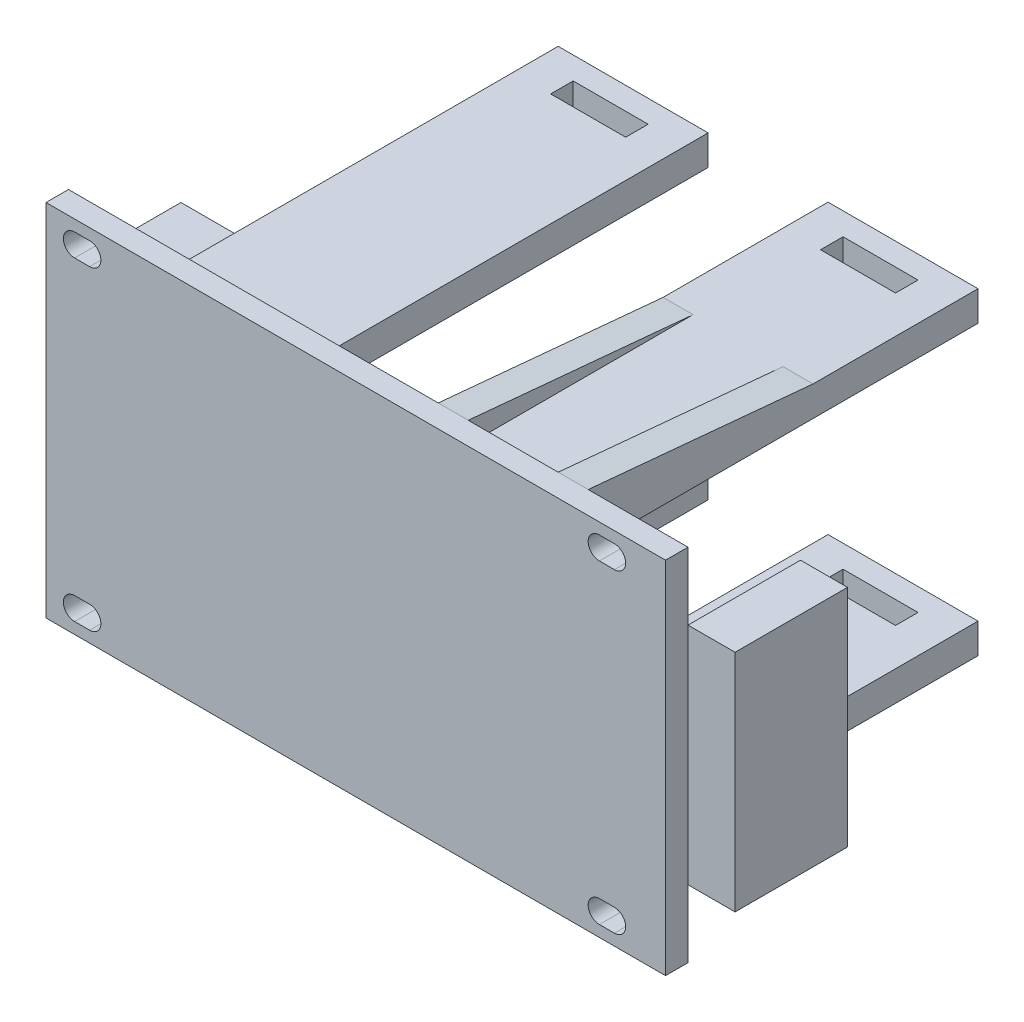
from build123d import *

# Parameters (mm, degrees)
SKETCH_2_W               = 82.637997944
SKETCH_2_H               = 48
EXTRUDE_1_DEPTH          = 3
SKETCH_3_W               = 20
SKETCH_3_H               = 4
EXTRUDE_2_DEPTH          = 53
SKETCH_4_W               = 13.514067067
SKETCH_4_H               = 30
EXTRUDE_3_DEPTH          = 15
SKETCH_5_W               = 6.276069123
SKETCH_5_H               = 30
EXTRUDE_4_DEPTH          = 15
SKETCH_6_W               = 10
SKETCH_6_H               = 3
CUT_EXTRUDE_1_DEPTH      = 83.290525013
MIRROR_START             = 8
MIRROR_2_OUTLINE_W       = 4
MIRROR_2_OUTLINE_H       = 46
MIRROR_2_OUTLINE_H_2     = 4
MIRROR_2_DEPTH           = 20
MIRROR_2_2_OUTLINE_W     = 4
MIRROR_2_2_OUTLINE_H     = 3
MIRROR_2_2_DEPTH         = 4
MIRROR_START_2           = 24
MIRROR_2_3_OUTLINE_W     = 4
MIRROR_2_3_OUTLINE_H     = 3
MIRROR_2_3_DEPTH         = 4
MIRROR_START_3           = 12
MIRROR_2_4_OUTLINE_W     = 4
MIRROR_2_4_OUTLINE_H     = 3
MIRROR_2_4_DEPTH         = 1
MIRROR_START_4           = 23
MIRROR_2_5_OUTLINE_W     = 4
MIRROR_2_5_OUTLINE_H     = 3
MIRROR_2_5_DEPTH         = 1
CUT_EXTRUDE_3_DEPTH      = 15
CUT_EXTRUDE_4_DEPTH      = 85.364272693
CUT_EXTRUDE_4_DEPTH_BACK = 85.364272693
SKETCH_10_W              = 56
SKETCH_10_H              = 1


with BuildPart() as part:
    # 草图2 → 凸台-拉伸1 (new body)
    with BuildSketch(Plane.XY):
        Rectangle(SKETCH_2_W, SKETCH_2_H)
    extrude(amount=EXTRUDE_1_DEPTH)

    # 草图3 → 凸台-拉伸2 (add)
    with BuildSketch(Plane(origin=(0, 0, 0), x_dir=(-1, 0, 0), z_dir=(0, 0, -1))):
        with Locations((18, 19.2)):
            Rectangle(SKETCH_3_W, SKETCH_3_H)
        with Locations((18, -19.2)):
            Rectangle(SKETCH_3_W, SKETCH_3_H)
    extrude(amount=EXTRUDE_2_DEPTH)

    # 草图4 → 凸台-拉伸3 (add)
    with BuildSketch(Plane(origin=(0, 0, 0), x_dir=(-1, 0, 0), z_dir=(0, 0, -1))):
        with Locations((34.561965439, 0)):
            Rectangle(SKETCH_4_W, SKETCH_4_H)
    extrude(amount=EXTRUDE_3_DEPTH)

    # 草图6 → 切除-拉伸1 (cut, symmetric)
    with BuildSketch(Plane(origin=(0, -17.2, 0), x_dir=(1, 0, 0), z_dir=(0, 1, 0))):
        with Locations((-18, 47.5)):
            Rectangle(SKETCH_6_W, SKETCH_6_H)
    extrude(amount=CUT_EXTRUDE_1_DEPTH, both=True, mode=Mode.SUBTRACT)

    # 镜向2: read off the stored shape, not the designer's step
    # 镜向2 outline → 镜向2 (add)
    with BuildSketch(Plane.YZ.offset(MIRROR_START)):
        with Locations((19.2, -23)):
            Rectangle(MIRROR_2_OUTLINE_W, MIRROR_2_OUTLINE_H)
        with Locations((-19.2, -23)):
            Rectangle(MIRROR_2_OUTLINE_W, MIRROR_2_OUTLINE_H)
        with Locations((19.2, -51)):
            Rectangle(MIRROR_2_OUTLINE_W, MIRROR_2_OUTLINE_H_2)
        with Locations((-19.2, -51)):
            Rectangle(MIRROR_2_OUTLINE_W, MIRROR_2_OUTLINE_H_2)
    extrude(amount=MIRROR_2_DEPTH)

    # Mirror 2 2 outline → Mirror 2 2 (add)
    with BuildSketch(Plane.YZ.offset(MIRROR_START)):
        with Locations((19.2, -47.5)):
            Rectangle(MIRROR_2_2_OUTLINE_W, MIRROR_2_2_OUTLINE_H)
        Polygon((24, 0), (21.2, 0), (21.2, -30), align=None)
        with Locations((-19.2, -47.5)):
            Rectangle(MIRROR_2_2_OUTLINE_W, MIRROR_2_2_OUTLINE_H)
        Polygon((-21.2, -30), (-21.2, 0), (-24, 0), align=None)
    extrude(amount=MIRROR_2_2_DEPTH)

    # Mirror 2 3 outline → Mirror 2 3 (add)
    with BuildSketch(Plane.YZ.offset(MIRROR_START_2)):
        with Locations((19.2, -47.5)):
            Rectangle(MIRROR_2_3_OUTLINE_W, MIRROR_2_3_OUTLINE_H)
        Polygon((24, 0), (21.2, 0), (21.2, -30), align=None)
        with Locations((-19.2, -47.5)):
            Rectangle(MIRROR_2_3_OUTLINE_W, MIRROR_2_3_OUTLINE_H)
        Polygon((-21.2, -30), (-21.2, 0), (-24, 0), align=None)
    extrude(amount=MIRROR_2_3_DEPTH)

    # Mirror 2 4 outline → Mirror 2 4 (add)
    with BuildSketch(Plane.YZ.offset(MIRROR_START_3)):
        with Locations((19.2, -47.5)):
            Rectangle(MIRROR_2_4_OUTLINE_W, MIRROR_2_4_OUTLINE_H)
        with Locations((-19.2, -47.5)):
            Rectangle(MIRROR_2_4_OUTLINE_W, MIRROR_2_4_OUTLINE_H)
    extrude(amount=MIRROR_2_4_DEPTH)

    # Mirror 2 5 outline → Mirror 2 5 (add)
    with BuildSketch(Plane.YZ.offset(MIRROR_START_4)):
        with Locations((19.2, -47.5)):
            Rectangle(MIRROR_2_5_OUTLINE_W, MIRROR_2_5_OUTLINE_H)
        with Locations((-19.2, -47.5)):
            Rectangle(MIRROR_2_5_OUTLINE_W, MIRROR_2_5_OUTLINE_H)
    extrude(amount=MIRROR_2_5_DEPTH)

    # 草图8 → 切除-拉伸3 (cut)
    with BuildSketch(Plane(origin=(0, 0, 0), x_dir=(-1, 0, 0), z_dir=(0, 0, -1))):
        with BuildLine():
            Line((37.5, -19.5), (35.5, -19.5))
            ThreePointArc((35.5, -19.5), (34, -21), (35.5, -22.5))
            Line((35.5, -22.5), (37.5, -22.5))
            ThreePointArc((37.5, -22.5), (39, -21), (37.5, -19.5))
        make_face()
        with BuildLine():
            Line((-32.5, -19.5), (-34.5, -19.5))
            ThreePointArc((-34.5, -19.5), (-36, -21), (-34.5, -22.5))
            Line((-34.5, -22.5), (-32.5, -22.5))
            ThreePointArc((-32.5, -22.5), (-31, -21), (-32.5, -19.5))
        make_face()
        with BuildLine():
            Line((-32.5, 22.5), (-34.5, 22.5))
            ThreePointArc((-34.5, 22.5), (-36, 21), (-34.5, 19.5))
            Line((-34.5, 19.5), (-32.5, 19.5))
            ThreePointArc((-32.5, 19.5), (-31, 21), (-32.5, 22.5))
        make_face()
        with BuildLine():
            Line((37.5, 19.5), (35.5, 19.5))
            ThreePointArc((35.5, 19.5), (34, 21), (35.5, 22.5))
            Line((35.5, 22.5), (37.5, 22.5))
            ThreePointArc((37.5, 22.5), (39, 21), (37.5, 19.5))
        make_face()
    extrude(amount=-CUT_EXTRUDE_3_DEPTH, mode=Mode.SUBTRACT)

    # 草图10 → 切除-拉伸4 (cut, two sides: drawn at the far end of the back side and taken through both)
    with BuildSketch(Plane(origin=(0, 21.2, 0), x_dir=(1, 0, 0), z_dir=(0, 1, 0)).offset(-CUT_EXTRUDE_4_DEPTH_BACK)):
        with Locations((0, 52.5)):
            Rectangle(SKETCH_10_W, SKETCH_10_H)
    extrude(amount=CUT_EXTRUDE_4_DEPTH + CUT_EXTRUDE_4_DEPTH_BACK, mode=Mode.SUBTRACT)


with BuildPart() as body_2:
    # 草图5 → 凸台-拉伸4 (new body)
    with BuildSketch(Plane(origin=(0, 0, 0), x_dir=(-1, 0, 0), z_dir=(0, 0, -1))):
        with Locations((-44.457033534, 0)):
            Rectangle(SKETCH_5_W, SKETCH_5_H)
    extrude(amount=EXTRUDE_4_DEPTH)


solid = Compound([part.part, body_2.part])
